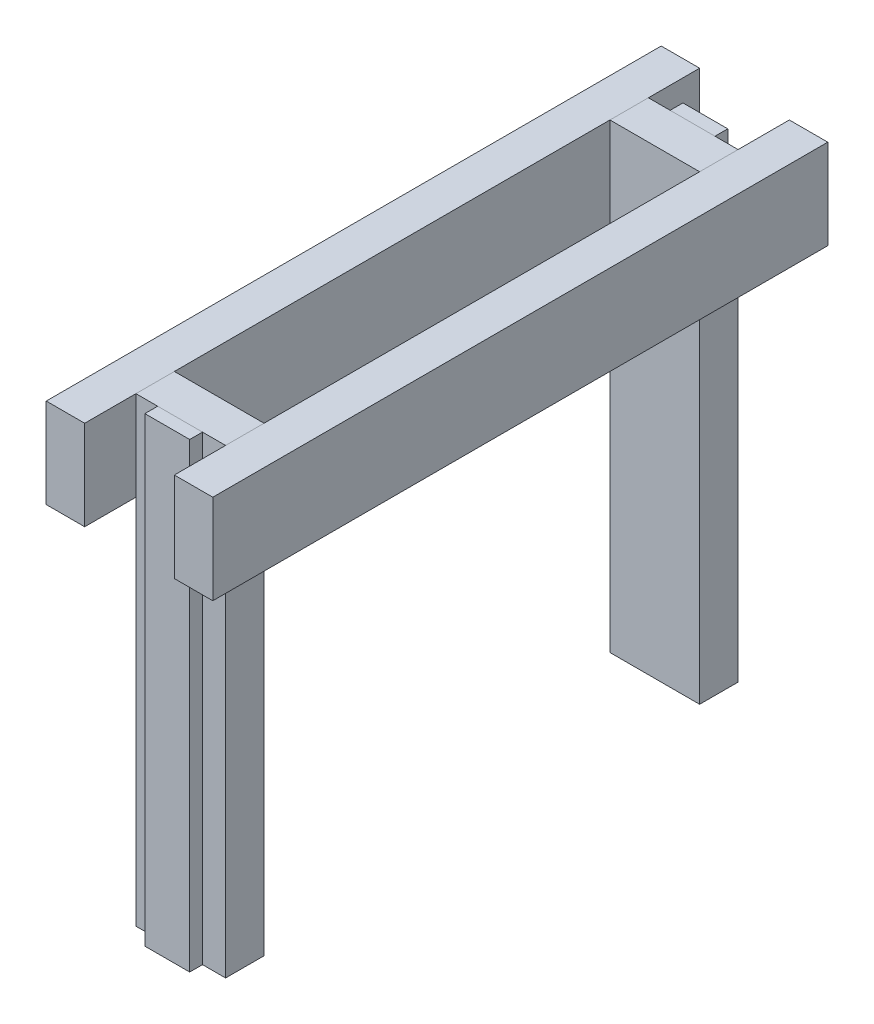
from build123d import *

# Parameters (mm, degrees)
SKETCH3_W            = 88.9
SKETCH3_H            = 38.1
VERTICAL_BOARD_DEPTH = 457.2
SKETCH6_W            = 609.6
SKETCH6_H            = 88.9
LATERAL_BOARD_DEPTH  = 38.1
SKETCH7_W            = 44.45
SKETCH7_H            = 457.2
DRAWER_SLIDE_DEPTH   = 12.7


with BuildPart() as part:
    # Sketch3 → Vertical Board (new body)
    with BuildSketch(Plane(origin=(0, 0, 0), x_dir=(1, 0, 0), z_dir=(0, 1, 0))):
        with Locations((0, -234.95)):
            Rectangle(SKETCH3_W, SKETCH3_H)
    extrude(amount=-VERTICAL_BOARD_DEPTH)


with BuildPart() as body_2:
    # Vertical Board Mirror: mirrored copy
    add(part.part.mirror(Plane.XY))


with BuildPart() as body_3:
    # Sketch6 → Lateral Board (new body)
    with BuildSketch(Plane(origin=(44.45, 0, 0), x_dir=(0, 0, -1), z_dir=(1, 0, 0))):
        with Locations((0, -44.45)):
            Rectangle(SKETCH6_W, SKETCH6_H)
    extrude(amount=LATERAL_BOARD_DEPTH)


with BuildPart() as body_4:
    # Lateral Board Mirror: mirrored copy
    add(body_3.part.mirror(Plane(origin=(0, 0, 0), x_dir=(0, 0, 1), z_dir=(1, 0, 0))))


with BuildPart() as body_5:
    # Sketch7 → Drawer Slide (new body)
    with BuildSketch(Plane.XY.offset(254)):
        with Locations((-0.675755403, -228.6)):
            Rectangle(SKETCH7_W, SKETCH7_H)
    extrude(amount=DRAWER_SLIDE_DEPTH)


with BuildPart() as body_6:
    # Drawer Slide Mirror: mirrored copy
    add(body_5.part.mirror(Plane.XY))


solid = Compound([part.part, body_2.part, body_3.part, body_4.part, body_5.part, body_6.part])
